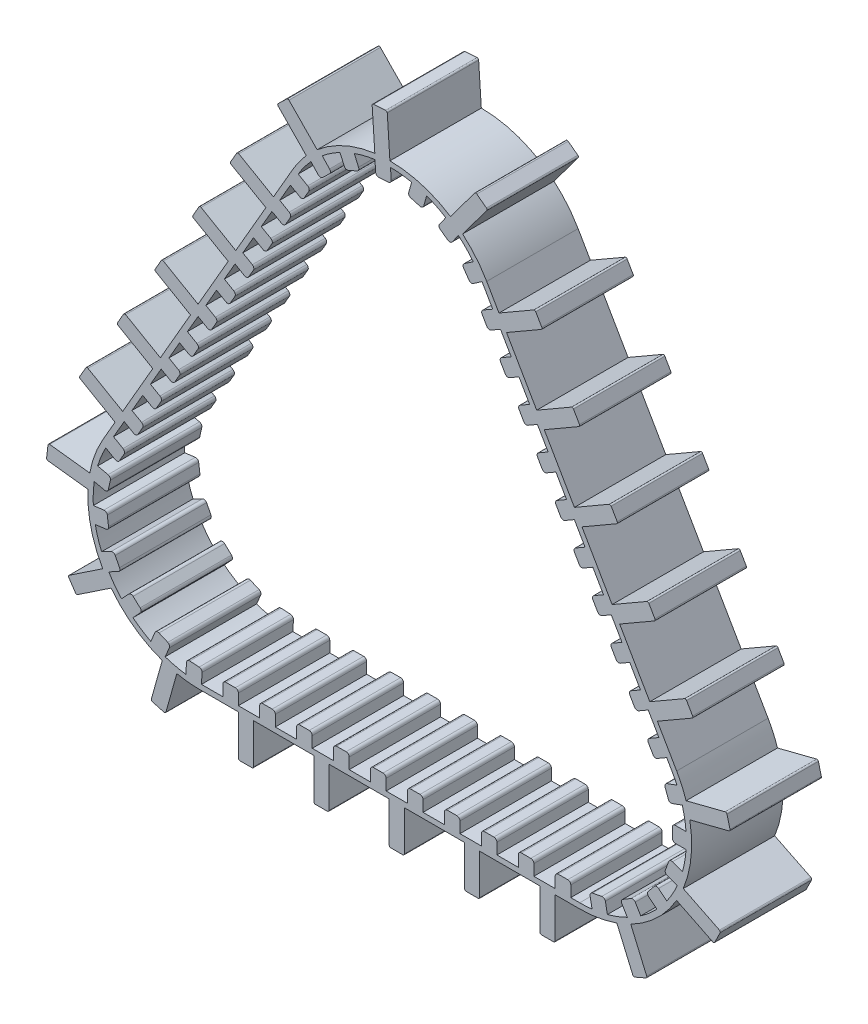
from build123d import *

# Parameters (mm, degrees)
EXTRUDE_THIN1_DEPTH = 60
BOSS_EXTRUDE4_DEPTH = 60
FILLET3_R           = 2
CRVPATTERN6_DEPTH   = 60
BOSS_EXTRUDE5_DEPTH = 60
FILLET4_R           = 1
CRVPATTERN8_DEPTH   = 60
SCALE1_SCALE        = 0.2


# Read off the part's stored shape, not the designer's step: CrvPattern6, CrvPattern8
with BuildPart() as part:
    # Sketch2 → Extrude-Thin1 (new body)
    with BuildSketch(Plane.XY):
        with BuildLine():
            Line((-249.41531629, -73.5), (0, -73.5))
            ThreePointArc((0, -73.5), (63.652867178, -36.75), (63.652867178, 36.75))
            Line((63.652867178, 36.75), (-61.054790967, 252.75))
            ThreePointArc((-61.054790967, 252.75), (-124.707658145, 289.5), (-188.360525323, 252.75))
            Line((-188.360525323, 252.75), (-313.068183468, 36.75))
            ThreePointArc((-313.068183468, 36.75), (-313.068183468, -36.75), (-249.41531629, -73.5))
        make_face()
        with BuildLine():
            Line((-249.41531629, -70), (0, -70))
            ThreePointArc((0, -70), (60.621778265, -35), (60.621778265, 35))
            Line((60.621778265, 35), (-64.08587988, 251))
            ThreePointArc((-64.08587988, 251), (-124.707658145, 286), (-185.32943641, 251))
            Line((-185.32943641, 251), (-310.037094555, 35))
            ThreePointArc((-310.037094555, 35), (-310.037094555, -35), (-249.41531629, -70))
        make_face(mode=Mode.SUBTRACT)
    extrude(amount=EXTRUDE_THIN1_DEPTH)

    # Sketch4 → Boss-Extrude4 (add)
    with BuildSketch(Plane.XY.offset(60)):
        Polygon((-254.685847855, 112.471171547), (-249.570790282, 121.330711146), (-257.538223997, 125.930711146), (-262.65328157, 117.071171547), align=None)
    extrude(amount=-BOSS_EXTRUDE4_DEPTH)

    # Fillet3
    fillet3_edges = [part.edges().sort_by_distance(p)[0] for p in [
        (-249.570790282, 121.330711146, 30),
        (-254.685847855, 112.471171547, 30),
    ]]
    fillet(fillet3_edges, radius=FILLET3_R)

    # CrvPattern6 outline → CrvPattern6 (add)
    with BuildSketch(Plane.XY):
        with BuildLine():
            ThreePointArc((-244.294746414, 134.46908719), (-242.777108324, 134.269286345), (-241.562695606, 135.201137997))
            Line((-241.562695606, 135.201137997), (-238.447638033, 140.596575981))
            ThreePointArc((-238.447638033, 140.596575981), (-238.247837188, 142.114214072), (-239.179688841, 143.328626789))
            Line((-239.179688841, 143.328626789), (-245.415071748, 146.928626789))
            Line((-245.415071748, 146.928626789), (-250.530129321, 138.06908719))
            Line((-250.530129321, 138.06908719), (-244.294746414, 134.46908719))
        make_face()
        with BuildLine():
            Line((-269.661376246, 104.932795503), (-274.776433819, 96.073255904))
            Line((-274.776433819, 96.073255904), (-268.541050911, 92.473255904))
            ThreePointArc((-268.541050911, 92.473255904), (-267.02341282, 92.273455059), (-265.809000103, 93.205306712))
            Line((-265.809000103, 93.205306712), (-262.693942531, 98.600744696))
            ThreePointArc((-262.693942531, 98.600744696), (-262.494141686, 100.118382786), (-263.425993338, 101.332795503))
            Line((-263.425993338, 101.332795503), (-269.661376246, 104.932795503))
        make_face()
        with BuildLine():
            Line((-281.784528495, 83.934879861), (-286.899586067, 75.075340262))
            Line((-286.899586067, 75.075340262), (-280.66420316, 71.475340262))
            ThreePointArc((-280.66420316, 71.475340262), (-279.14656507, 71.275539417), (-277.932152352, 72.207391069))
            Line((-277.932152352, 72.207391069), (-274.81709478, 77.602829053))
            ThreePointArc((-274.81709478, 77.602829053), (-274.617293935, 79.120467143), (-275.549145587, 80.334879861))
            Line((-275.549145587, 80.334879861), (-281.784528495, 83.934879861))
        make_face()
        with BuildLine():
            Line((-293.907680743, 62.936964218), (-299.022738316, 54.077424619))
            Line((-299.022738316, 54.077424619), (-292.787355408, 50.477424619))
            ThreePointArc((-292.787355408, 50.477424619), (-291.269717318, 50.277623774), (-290.055304601, 51.209475427))
            Line((-290.055304601, 51.209475427), (-286.940247028, 56.604913411))
            ThreePointArc((-286.940247028, 56.604913411), (-286.740446183, 58.122551501), (-287.672297836, 59.336964218))
            Line((-287.672297836, 59.336964218), (-293.907680743, 62.936964218))
        make_face()
        with BuildLine():
            ThreePointArc((-310.037094555, 35), (-310.583954637, 34.035241776), (-311.11546246, 33.061941302))
            Line((-311.11546246, 33.061941302), (-304.910507657, 29.479508976))
            ThreePointArc((-304.910507657, 29.479508976), (-303.392869566, 29.279708131), (-302.178456849, 30.211559784))
            Line((-302.178456849, 30.211559784), (-299.063399277, 35.606997768))
            ThreePointArc((-299.063399277, 35.606997768), (-298.863598432, 37.124635859), (-299.795450085, 38.339048576))
            Line((-299.795450085, 38.339048576), (-306.030832992, 41.939048576))
            Line((-306.030832992, 41.939048576), (-310.037094555, 35))
        make_face()
        with BuildLine():
            ThreePointArc((-316.457199384, 20.134197557), (-317.749224081, 15.181470482), (-318.675887828, 10.147572628))
            Line((-318.675887828, 10.147572628), (-311.829937788, 8.626635339))
            ThreePointArc((-311.829937788, 8.626635339), (-310.322340092, 8.891767267), (-309.443784123, 10.145276405))
            Line((-309.443784123, 10.145276405), (-308.092608277, 16.227106603))
            ThreePointArc((-308.092608277, 16.227106603), (-308.357740205, 17.734704298), (-309.611249343, 18.613260268))
            Line((-309.611249343, 18.613260268), (-316.457199384, 20.134197557))
        make_face()
        with BuildLine():
            ThreePointArc((-319.310913805, -3.821707469), (-318.844797619, -8.918919354), (-318.007462777, -13.968444447))
            Line((-318.007462777, -13.968444447), (-311.051754025, -13.074913281))
            ThreePointArc((-311.051754025, -13.074913281), (-309.723703566, -12.313711778), (-309.322880826, -10.836387547))
            Line((-309.322880826, -10.836387547), (-310.116679319, -4.657049503))
            ThreePointArc((-310.116679319, -4.657049503), (-310.877880823, -3.328999044), (-312.355205053, -2.928176303))
            Line((-312.355205053, -2.928176303), (-319.310913805, -3.821707469))
        make_face()
        with BuildLine():
            ThreePointArc((-313.862328281, -27.323664567), (-311.693437164, -31.959907078), (-309.191563575, -36.425269532))
            Line((-309.191563575, -36.425269532), (-302.952305235, -33.223404832))
            ThreePointArc((-302.952305235, -33.223404832), (-301.961549763, -32.056550366), (-302.086070555, -30.530889748))
            Line((-302.086070555, -30.530889748), (-304.930554857, -24.988034547))
            ThreePointArc((-304.930554857, -24.988034547), (-306.097409323, -23.997279075), (-307.623069941, -24.121799867))
            Line((-307.623069941, -24.121799867), (-313.862328281, -27.323664567))
        make_face()
        with BuildLine():
            ThreePointArc((-300.758633664, -47.580077354), (-297.144591633, -51.204650914), (-293.275355453, -54.555448533))
            Line((-293.275355453, -54.555448533), (-288.493655635, -49.42557241))
            ThreePointArc((-288.493655635, -49.42557241), (-287.957878514, -47.991665639), (-288.592952079, -46.598888802))
            Line((-288.592952079, -46.598888802), (-293.150250239, -42.350904786))
            ThreePointArc((-293.150250239, -42.350904786), (-294.58415701, -41.815127665), (-295.976933846, -42.450201231))
            Line((-295.976933846, -42.450201231), (-300.758633664, -47.580077354))
        make_face()
        with BuildLine():
            ThreePointArc((-281.556305711, -62.184859886), (-276.926393894, -64.367232417), (-272.14938858, -66.205452624))
            Line((-272.14938858, -66.205452624), (-269.393224489, -59.756899166))
            ThreePointArc((-269.393224489, -59.756899166), (-269.376066099, -58.226261606), (-270.446257484, -57.131804594))
            Line((-270.446257484, -57.131804594), (-276.175047049, -54.683273433))
            ThreePointArc((-276.175047049, -54.683273433), (-277.705684609, -54.666115044), (-278.800141621, -55.736306428))
            Line((-278.800141621, -55.736306428), (-281.556305711, -62.184859886))
        make_face()
        with BuildLine():
            Line((-249.41531629, -70), (-248.323526656, -70))
            Line((-248.323526656, -70), (-247.919788576, -62.990215199))
            ThreePointArc((-247.919788576, -62.990215199), (-248.423287016, -61.544658188), (-249.801477342, -60.878522184))
            Line((-249.801477342, -60.878522184), (-256.02128442, -60.520283945))
            ThreePointArc((-256.02128442, -60.520283945), (-257.466841431, -61.023782385), (-258.132977435, -62.40197271))
            Line((-258.132977435, -62.40197271), (-258.53622465, -69.403235016))
            ThreePointArc((-258.53622465, -69.403235016), (-253.985521366, -69.850649428), (-249.41531629, -70))
        make_face()
        with BuildLine():
            Line((-234.311365102, -70), (-224.081249957, -70))
            Line((-224.081249957, -70), (-224.081249957, -62.8))
            ThreePointArc((-224.081249957, -62.8), (-224.667036395, -61.385786437), (-226.081249957, -60.8))
            Line((-226.081249957, -60.8), (-232.311365102, -60.8))
            ThreePointArc((-232.311365102, -60.8), (-233.725578664, -61.385786438), (-234.311365102, -62.8))
            Line((-234.311365102, -62.8), (-234.311365102, -70))
        make_face()
        with BuildLine():
            Line((-210.065060604, -70), (-199.834945459, -70))
            Line((-199.834945459, -70), (-199.834945459, -62.8))
            ThreePointArc((-199.834945459, -62.8), (-200.420731897, -61.385786438), (-201.834945459, -60.8))
            Line((-201.834945459, -60.8), (-208.065060604, -60.8))
            ThreePointArc((-208.065060604, -60.8), (-209.479274167, -61.385786437), (-210.065060604, -62.8))
            Line((-210.065060604, -62.8), (-210.065060604, -70))
        make_face()
        with BuildLine():
            Line((-185.818756107, -70), (-175.588640962, -70))
            Line((-175.588640962, -70), (-175.588640962, -62.8))
            ThreePointArc((-175.588640962, -62.8), (-176.1744274, -61.385786438), (-177.588640962, -60.8))
            Line((-177.588640962, -60.8), (-183.818756107, -60.8))
            ThreePointArc((-183.818756107, -60.8), (-185.232969669, -61.385786438), (-185.818756107, -62.8))
            Line((-185.818756107, -62.8), (-185.818756107, -70))
        make_face()
        with BuildLine():
            Line((-161.57245161, -70), (-151.342336465, -70))
            Line((-151.342336465, -70), (-151.342336465, -62.8))
            ThreePointArc((-151.342336465, -62.8), (-151.928122903, -61.385786438), (-153.342336465, -60.8))
            Line((-153.342336465, -60.8), (-159.57245161, -60.8))
            ThreePointArc((-159.57245161, -60.8), (-160.986665172, -61.385786438), (-161.57245161, -62.8))
            Line((-161.57245161, -62.8), (-161.57245161, -70))
        make_face()
        with BuildLine():
            Line((-137.326147112, -70), (-127.096031967, -70))
            Line((-127.096031967, -70), (-127.096031967, -62.8))
            ThreePointArc((-127.096031967, -62.8), (-127.681818405, -61.385786438), (-129.096031967, -60.8))
            Line((-129.096031967, -60.8), (-135.326147112, -60.8))
            ThreePointArc((-135.326147112, -60.8), (-136.740360675, -61.385786437), (-137.326147112, -62.8))
            Line((-137.326147112, -62.8), (-137.326147112, -70))
        make_face()
        with BuildLine():
            Line((-113.079842615, -70), (-102.84972747, -70))
            Line((-102.84972747, -70), (-102.84972747, -62.8))
            ThreePointArc((-102.84972747, -62.8), (-103.435513907, -61.385786437), (-104.84972747, -60.8))
            Line((-104.84972747, -60.8), (-111.079842615, -60.8))
            ThreePointArc((-111.079842615, -60.8), (-112.494056177, -61.385786438), (-113.079842615, -62.8))
            Line((-113.079842615, -62.8), (-113.079842615, -70))
        make_face()
        with BuildLine():
            Line((-88.833538117, -70), (-78.603422972, -70))
            Line((-78.603422972, -70), (-78.603422972, -62.8))
            ThreePointArc((-78.603422972, -62.8), (-79.18920941, -61.385786438), (-80.603422972, -60.8))
            Line((-80.603422972, -60.8), (-86.833538117, -60.8))
            ThreePointArc((-86.833538117, -60.8), (-88.247751679, -61.385786438), (-88.833538117, -62.8))
            Line((-88.833538117, -62.8), (-88.833538117, -70))
        make_face()
        with BuildLine():
            Line((-64.58723362, -70), (-54.357118475, -70))
            Line((-54.357118475, -70), (-54.357118475, -62.8))
            ThreePointArc((-54.357118475, -62.8), (-54.942904913, -61.385786438), (-56.357118475, -60.8))
            Line((-56.357118475, -60.8), (-62.58723362, -60.8))
            ThreePointArc((-62.58723362, -60.8), (-64.001447182, -61.385786438), (-64.58723362, -62.8))
            Line((-64.58723362, -62.8), (-64.58723362, -70))
        make_face()
        with BuildLine():
            Line((-40.340929123, -70), (-30.110813978, -70))
            Line((-30.110813978, -70), (-30.110813978, -62.8))
            ThreePointArc((-30.110813978, -62.8), (-30.696600416, -61.385786437), (-32.110813978, -60.8))
            Line((-32.110813978, -60.8), (-38.340929123, -60.8))
            ThreePointArc((-38.340929123, -60.8), (-39.755142685, -61.385786438), (-40.340929123, -62.8))
            Line((-40.340929123, -62.8), (-40.340929123, -70))
        make_face()
        with BuildLine():
            Line((-16.094624625, -70), (-5.86450948, -70))
            Line((-5.86450948, -70), (-5.86450948, -62.8))
            ThreePointArc((-5.86450948, -62.8), (-6.450295918, -61.385786438), (-7.86450948, -60.8))
            Line((-7.86450948, -60.8), (-14.094624625, -60.8))
            ThreePointArc((-14.094624625, -60.8), (-15.508838188, -61.385786437), (-16.094624625, -62.8))
            Line((-16.094624625, -62.8), (-16.094624625, -70))
        make_face()
        with BuildLine():
            ThreePointArc((8.128735827, -69.526424141), (13.187457187, -68.746570627), (18.175669161, -67.599149777))
            Line((18.175669161, -67.599149777), (16.854499686, -60.711857609))
            ThreePointArc((16.854499686, -60.711857609), (16.01277555, -59.433324766), (14.513527463, -59.124454368))
            Line((14.513527463, -59.124454368), (8.394969594, -60.29815975))
            ThreePointArc((8.394969594, -60.29815975), (7.116436751, -61.139883886), (6.807566352, -62.639131973))
            Line((6.807566352, -62.639131973), (8.128735827, -69.526424141))
        make_face()
        with BuildLine():
            ThreePointArc((31.249564339, -62.637566433), (35.743091285, -60.186638263), (40.04551062, -57.413910154))
            Line((40.04551062, -57.413910154), (36.464632178, -51.384184474))
            ThreePointArc((36.464632178, -51.384184474), (35.238848166, -50.467342446), (33.723782763, -50.685797418))
            Line((33.723782763, -50.685797418), (28.367072955, -53.866991337))
            ThreePointArc((28.367072955, -53.866991337), (27.450230926, -55.092775349), (27.668685898, -56.607840752))
            Line((27.668685898, -56.607840752), (31.249564339, -62.637566433))
        make_face()
        with BuildLine():
            ThreePointArc((50.6585245, -48.308528186), (54.053109415, -44.477650146), (57.158688534, -40.408963425))
            Line((57.158688534, -40.408963425), (51.743443035, -35.953023751))
            ThreePointArc((51.743443035, -35.953023751), (50.27919954, -35.506776356), (48.928278477, -36.226608301))
            Line((48.928278477, -36.226608301), (44.969694451, -41.037423953))
            ThreePointArc((44.969694451, -41.037423953), (44.523447056, -42.501667448), (45.243279001, -43.852588512))
            Line((45.243279001, -43.852588512), (50.6585245, -48.308528186))
        make_face()
        with BuildLine():
            ThreePointArc((64.050192012, -28.241333242), (65.942621201, -23.485542555), (67.482474934, -18.604181702))
            Line((67.482474934, -18.604181702), (60.876093053, -16.251310979))
            ThreePointArc((60.876093053, -16.251310979), (59.347315031, -16.328664127), (58.32100266, -17.464370369))
            Line((58.32100266, -17.464370369), (56.230750741, -23.333372127))
            ThreePointArc((56.230750741, -23.333372127), (56.308103889, -24.862150149), (57.443810131, -25.88846252))
            Line((57.443810131, -25.88846252), (64.050192012, -28.241333242))
        make_face()
        with BuildLine():
            ThreePointArc((69.833885279, -4.819591979), (69.999373273, 0.296211675), (69.790595571, 5.410431573))
            Line((69.790595571, 5.410431573), (62.777792883, 5.380755964))
            ThreePointArc((62.777792883, 5.380755964), (61.366070793, 4.788990392), (60.78627398, 3.37231068))
            Line((60.78627398, 3.37231068), (60.812637306, -2.857748685))
            ThreePointArc((60.812637306, -2.857748685), (61.404402878, -4.269470774), (62.82108259, -4.849267588))
            Line((62.82108259, -4.849267588), (69.833885279, -4.819591979))
        make_face()
        with BuildLine():
            ThreePointArc((67.32260887, 19.174627375), (65.741498766, 24.042781454), (63.808888546, 28.782385978))
            Line((63.808888546, 28.782385978), (57.222655873, 26.373688949))
            ThreePointArc((57.222655873, 26.373688949), (56.095676104, 25.337801721), (56.03126395, 23.8084238))
            Line((56.03126395, 23.8084238), (58.171111048, 17.957322269))
            ThreePointArc((58.171111048, 17.957322269), (59.206998276, 16.8303425), (60.736376197, 16.765930346))
            Line((60.736376197, 16.765930346), (67.32260887, 19.174627375))
        make_face()
        with BuildLine():
            Line((57.11085342, 41.081100212), (51.995795848, 49.940639812))
            Line((51.995795848, 49.940639812), (45.760412941, 46.340639812))
            ThreePointArc((45.760412941, 46.340639812), (44.828561288, 45.126227095), (45.028362133, 43.608589004))
            Line((45.028362133, 43.608589004), (48.143419706, 38.21315102))
            ThreePointArc((48.143419706, 38.21315102), (49.357832423, 37.281299367), (50.875470513, 37.481100212))
            Line((50.875470513, 37.481100212), (57.11085342, 41.081100212))
        make_face()
        with BuildLine():
            Line((44.987701172, 62.079015855), (39.872643599, 70.938555454))
            Line((39.872643599, 70.938555454), (33.637260692, 67.338555454))
            ThreePointArc((33.637260692, 67.338555454), (32.705409039, 66.124142737), (32.905209884, 64.606504647))
            Line((32.905209884, 64.606504647), (36.020267457, 59.211066662))
            ThreePointArc((36.020267457, 59.211066662), (37.234680174, 58.27921501), (38.752318264, 58.479015855))
            Line((38.752318264, 58.479015855), (44.987701172, 62.079015855))
        make_face()
        with BuildLine():
            Line((32.864548923, 83.076931498), (27.74949135, 91.936471097))
            Line((27.74949135, 91.936471097), (21.514108443, 88.336471097))
            ThreePointArc((21.514108443, 88.336471097), (20.582256791, 87.122058379), (20.782057636, 85.604420289))
            Line((20.782057636, 85.604420289), (23.897115208, 80.208982305))
            ThreePointArc((23.897115208, 80.208982305), (25.111527926, 79.277130653), (26.629166016, 79.476931498))
            Line((26.629166016, 79.476931498), (32.864548923, 83.076931498))
        make_face()
        with BuildLine():
            Line((20.741396674, 104.07484714), (15.626339102, 112.934386739))
            Line((15.626339102, 112.934386739), (9.390956195, 109.334386739))
            ThreePointArc((9.390956195, 109.334386739), (8.459104542, 108.119974022), (8.658905387, 106.602335932))
            Line((8.658905387, 106.602335932), (11.773962959, 101.206897948))
            ThreePointArc((11.773962959, 101.206897948), (12.988375676, 100.275046295), (14.506013767, 100.47484714))
            Line((14.506013767, 100.47484714), (20.741396674, 104.07484714))
        make_face()
        with BuildLine():
            Line((8.618244426, 125.072762783), (3.503186853, 133.932302382))
            Line((3.503186853, 133.932302382), (-2.732196054, 130.332302382))
            ThreePointArc((-2.732196054, 130.332302382), (-3.664047707, 129.117889665), (-3.464246862, 127.600251574))
            Line((-3.464246862, 127.600251574), (-0.349189289, 122.20481359))
            ThreePointArc((-0.349189289, 122.20481359), (0.865223428, 121.272961938), (2.382861518, 121.472762783))
            Line((2.382861518, 121.472762783), (8.618244426, 125.072762783))
        make_face()
        with BuildLine():
            Line((-3.504907823, 146.070678425), (-8.619965396, 154.930218025))
            Line((-8.619965396, 154.930218025), (-14.855348303, 151.330218025))
            ThreePointArc((-14.855348303, 151.330218025), (-15.787199955, 150.115805307), (-15.58739911, 148.598167217))
            Line((-15.58739911, 148.598167217), (-12.472341538, 143.202729233))
            ThreePointArc((-12.472341538, 143.202729233), (-11.257928821, 142.27087758), (-9.74029073, 142.470678425))
            Line((-9.74029073, 142.470678425), (-3.504907823, 146.070678425))
        make_face()
        with BuildLine():
            Line((-15.628060072, 167.068594068), (-20.743117644, 175.928133667))
            Line((-20.743117644, 175.928133667), (-26.978500552, 172.328133667))
            ThreePointArc((-26.978500552, 172.328133667), (-27.910352204, 171.11372095), (-27.710551359, 169.59608286))
            Line((-27.710551359, 169.59608286), (-24.595493787, 164.200644876))
            ThreePointArc((-24.595493787, 164.200644876), (-23.38108107, 163.268793223), (-21.863442979, 163.468594068))
            Line((-21.863442979, 163.468594068), (-15.628060072, 167.068594068))
        make_face()
        with BuildLine():
            Line((-27.75121232, 188.066509711), (-32.866269893, 196.92604931))
            Line((-32.866269893, 196.92604931), (-39.1016528, 193.32604931))
            ThreePointArc((-39.1016528, 193.32604931), (-40.033504453, 192.111636593), (-39.833703608, 190.593998502))
            Line((-39.833703608, 190.593998502), (-36.718646035, 185.198560518))
            ThreePointArc((-36.718646035, 185.198560518), (-35.504233318, 184.266708866), (-33.986595228, 184.466509711))
            Line((-33.986595228, 184.466509711), (-27.75121232, 188.066509711))
        make_face()
        with BuildLine():
            Line((-39.874364569, 209.064425353), (-44.989422142, 217.923964953))
            Line((-44.989422142, 217.923964953), (-51.224805049, 214.323964953))
            ThreePointArc((-51.224805049, 214.323964953), (-52.156656702, 213.109552236), (-51.956855857, 211.591914145))
            Line((-51.956855857, 211.591914145), (-48.841798284, 206.196476161))
            ThreePointArc((-48.841798284, 206.196476161), (-47.627385567, 205.264624508), (-46.109747476, 205.464425353))
            Line((-46.109747476, 205.464425353), (-39.874364569, 209.064425353))
        make_face()
        with BuildLine():
            Line((-51.997516818, 230.062340996), (-57.11257439, 238.921880595))
            Line((-57.11257439, 238.921880595), (-63.347957298, 235.321880595))
            ThreePointArc((-63.347957298, 235.321880595), (-64.27980895, 234.107467878), (-64.080008105, 232.589829788))
            Line((-64.080008105, 232.589829788), (-60.964950533, 227.194391804))
            ThreePointArc((-60.964950533, 227.194391804), (-59.750537816, 226.262540151), (-58.232899725, 226.462340996))
            Line((-58.232899725, 226.462340996), (-51.997516818, 230.062340996))
        make_face()
        with BuildLine():
            ThreePointArc((-64.118413713, 251.056289866), (-66.842032003, 255.389964601), (-69.875040476, 259.513032985))
            Line((-69.875040476, 259.513032985), (-75.67223836, 255.566796944))
            ThreePointArc((-75.67223836, 255.566796944), (-76.511670449, 254.28675807), (-76.200114404, 252.78806578))
            Line((-76.200114404, 252.78806578), (-72.69434276, 247.637929869))
            ThreePointArc((-72.69434276, 247.637929869), (-71.414303886, 246.79849778), (-69.915611596, 247.110053825))
            Line((-69.915611596, 247.110053825), (-64.118413713, 251.056289866))
        make_face()
        with BuildLine():
            ThreePointArc((-79.618149954, 269.543778827), (-83.651254454, 272.69542941), (-87.903875255, 275.543946501))
            Line((-87.903875255, 275.543946501), (-92.017061484, 269.863983365))
            ThreePointArc((-92.017061484, 269.863983365), (-92.372077331, 268.374987226), (-91.570232177, 267.071073847))
            Line((-91.570232177, 267.071073847), (-86.5242457, 263.416986384))
            ThreePointArc((-86.5242457, 263.416986384), (-85.035249562, 263.061970537), (-83.731336183, 263.86381569))
            Line((-83.731336183, 263.86381569), (-79.618149954, 269.543778827))
        make_face()
        with BuildLine():
            ThreePointArc((-100.47368305, 281.671260465), (-105.337215786, 283.266529291), (-110.304316479, 284.502144119))
            Line((-110.304316479, 284.502144119), (-112.244920858, 277.763128105))
            ThreePointArc((-112.244920858, 277.763128105), (-112.073351168, 276.242039813), (-110.876461231, 275.287786058))
            Line((-110.876461231, 275.287786058), (-104.889629475, 273.563784825))
            ThreePointArc((-104.889629475, 273.563784825), (-103.368541183, 273.735354514), (-102.414287428, 274.932244451))
            Line((-102.414287428, 274.932244451), (-100.47368305, 281.671260465))
        make_face()
        with BuildLine():
            ThreePointArc((-124.207762682, 285.99821501), (-129.324026217, 285.847613745), (-134.415607414, 285.323558196))
            Line((-134.415607414, 285.323558196), (-133.953122153, 278.325959353))
            ThreePointArc((-133.953122153, 278.325959353), (-133.275346222, 276.953455969), (-131.825579815, 276.462209476))
            Line((-131.825579815, 276.462209476), (-125.609027297, 276.873073829))
            ThreePointArc((-125.609027297, 276.873073829), (-124.236523914, 277.55084976), (-123.745277421, 279.000616166))
            Line((-123.745277421, 279.000616166), (-124.207762682, 285.99821501))
        make_face()
        with BuildLine():
            ThreePointArc((-148.001220619, 282.010680555), (-152.762497787, 280.132097835), (-157.373774124, 277.910619984))
            Line((-157.373774124, 277.910619984), (-154.56313389, 271.485623201))
            ThreePointArc((-154.56313389, 271.485623201), (-153.459658921, 270.424732659), (-151.929221391, 270.454844396))
            Line((-151.929221391, 270.454844396), (-146.221359191, 272.951771272))
            ThreePointArc((-146.221359191, 272.951771272), (-145.160468648, 274.055246241), (-145.190580385, 275.585683771))
            Line((-145.190580385, 275.585683771), (-148.001220619, 282.010680555))
        make_face()
        with BuildLine():
            ThreePointArc((-169.027835588, 270.182302197), (-172.868575015, 266.798878789), (-176.451812435, 263.143848982))
            Line((-176.451812435, 263.143848982), (-171.626869131, 258.054624649))
            ThreePointArc((-171.626869131, 258.054624649), (-170.228767473, 257.431361058), (-168.799446398, 257.979254309))
            Line((-168.799446398, 257.979254309), (-164.278262625, 262.265655131))
            ThreePointArc((-164.278262625, 262.265655131), (-163.654999034, 263.663756789), (-164.202892285, 265.093077865))
            Line((-164.202892285, 265.093077865), (-169.027835588, 270.182302197))
        make_face()
        with BuildLine():
            Line((-185.32943641, 251), (-189.914368077, 243.058665403))
            Line((-189.914368077, 243.058665403), (-183.67898517, 239.458665403))
            ThreePointArc((-183.67898517, 239.458665403), (-182.16134708, 239.258864558), (-180.946934363, 240.19071621))
            Line((-180.946934363, 240.19071621), (-177.83187679, 245.586154194))
            ThreePointArc((-177.83187679, 245.586154194), (-177.632075945, 247.103792285), (-178.563927598, 248.318205002))
            Line((-178.563927598, 248.318205002), (-184.792356331, 251.914190008))
            ThreePointArc((-184.792356331, 251.914190008), (-185.062627287, 251.458111905), (-185.32943641, 251))
        make_face()
        with BuildLine():
            Line((-196.922462754, 230.920289359), (-202.037520326, 222.06074976))
            Line((-202.037520326, 222.06074976), (-195.802137419, 218.46074976))
            ThreePointArc((-195.802137419, 218.46074976), (-194.284499328, 218.260948915), (-193.070086611, 219.192800568))
            Line((-193.070086611, 219.192800568), (-189.955029039, 224.588238552))
            ThreePointArc((-189.955029039, 224.588238552), (-189.755228194, 226.105876642), (-190.687079846, 227.320289359))
            Line((-190.687079846, 227.320289359), (-196.922462754, 230.920289359))
        make_face()
        with BuildLine():
            Line((-209.045615002, 209.922373717), (-214.160672575, 201.062834117))
            Line((-214.160672575, 201.062834117), (-207.925289667, 197.462834117))
            ThreePointArc((-207.925289667, 197.462834117), (-206.407651577, 197.263033272), (-205.19323886, 198.194884925))
            Line((-205.19323886, 198.194884925), (-202.078181287, 203.590322909))
            ThreePointArc((-202.078181287, 203.590322909), (-201.878380442, 205.107961), (-202.810232095, 206.322373717))
            Line((-202.810232095, 206.322373717), (-209.045615002, 209.922373717))
        make_face()
        with BuildLine():
            Line((-221.168767251, 188.924458074), (-226.283824823, 180.064918475))
            Line((-226.283824823, 180.064918475), (-220.048441916, 176.464918475))
            ThreePointArc((-220.048441916, 176.464918475), (-218.530803826, 176.26511763), (-217.316391109, 177.196969282))
            Line((-217.316391109, 177.196969282), (-214.201333536, 182.592407266))
            ThreePointArc((-214.201333536, 182.592407266), (-214.001532691, 184.110045357), (-214.933384344, 185.324458074))
            Line((-214.933384344, 185.324458074), (-221.168767251, 188.924458074))
        make_face()
        with BuildLine():
            Line((-233.2919195, 167.926542431), (-238.406977072, 159.067002832))
            Line((-238.406977072, 159.067002832), (-232.171594165, 155.467002832))
            ThreePointArc((-232.171594165, 155.467002832), (-230.653956074, 155.267201987), (-229.439543357, 156.19905364))
            Line((-229.439543357, 156.19905364), (-226.324485785, 161.594491624))
            ThreePointArc((-226.324485785, 161.594491624), (-226.12468494, 163.112129714), (-227.056536592, 164.326542431))
            Line((-227.056536592, 164.326542431), (-233.2919195, 167.926542431))
        make_face()
    extrude(amount=CRVPATTERN6_DEPTH)

    # Sketch6 → Boss-Extrude5 (add)
    with BuildSketch(Plane.XY.offset(60)):
        Polygon((-136.308864095, 316.253168116), (-126.401592242, 316.907959468), (-124.406757868, 286.725266347), (-134.314029721, 286.070474994), align=None)
    extrude(amount=-BOSS_EXTRUDE5_DEPTH)

    # Fillet4
    fillet4_edges = [part.edges().sort_by_distance(p)[0] for p in [
        (-126.401592242, 316.907959468, 30),
        (-136.308864095, 316.253168116, 30),
    ]]
    fillet(fillet4_edges, radius=FILLET4_R)

    # CrvPattern8 outline → CrvPattern8 (add)
    with BuildSketch(Plane.XY):
        with BuildLine():
            ThreePointArc((-67.591407991, 299.151011892), (-68.333266762, 299.339245794), (-68.990941598, 298.947773895))
            Line((-68.990941598, 298.947773895), (-84.82262764, 277.736815123))
            ThreePointArc((-84.82262764, 277.736815123), (-80.743794517, 274.901856463), (-76.865758962, 271.797873458))
            Line((-76.865758962, 271.797873458), (-61.034072919, 293.008832229))
            ThreePointArc((-61.034072919, 293.008832229), (-60.845839018, 293.750691), (-61.237310917, 294.408365836))
            Line((-61.237310917, 294.408365836), (-67.591407991, 299.151011892))
        make_face()
        with BuildLine():
            Line((-197.962453997, 283.958962481), (-179.476921648, 265.016097105))
            ThreePointArc((-179.476921648, 265.016097105), (-176.041130848, 268.603465478), (-172.370883027, 271.95057635))
            Line((-172.370883027, 271.95057635), (-190.856415376, 290.893441726))
            ThreePointArc((-190.856415376, 290.893441726), (-191.559890817, 291.19495249), (-192.270523378, 290.91072054))
            Line((-192.270523378, 290.91072054), (-197.945175183, 285.373070484))
            ThreePointArc((-197.945175183, 285.373070484), (-198.246685947, 284.669595042), (-197.962453997, 283.958962481))
        make_face()
        with BuildLine():
            Line((-228.780032887, 235.341359283), (-206.003564767, 222.191359283))
            Line((-206.003564767, 222.191359283), (-201.039121513, 230.79002723))
            Line((-201.039121513, 230.79002723), (-223.815589633, 243.94002723))
            ThreePointArc((-223.815589633, 243.94002723), (-224.574408678, 244.039927652), (-225.181615037, 243.574001826))
            Line((-225.181615037, 243.574001826), (-229.146058291, 236.707384686))
            ThreePointArc((-229.146058291, 236.707384686), (-229.245958713, 235.948565641), (-228.780032887, 235.341359283))
        make_face()
        with BuildLine():
            Line((-253.531468728, 192.470614846), (-230.755000608, 179.320614846))
            Line((-230.755000608, 179.320614846), (-225.790557354, 187.919282793))
            Line((-225.790557354, 187.919282793), (-248.567025474, 201.069282793))
            ThreePointArc((-248.567025474, 201.069282793), (-249.325844519, 201.169183215), (-249.933050878, 200.703257389))
            Line((-249.933050878, 200.703257389), (-253.897494132, 193.836640249))
            ThreePointArc((-253.897494132, 193.836640249), (-253.997394554, 193.077821204), (-253.531468728, 192.470614846))
        make_face()
        with BuildLine():
            Line((-278.282904569, 149.599870409), (-255.506436449, 136.449870409))
            Line((-255.506436449, 136.449870409), (-250.541993196, 145.048538355))
            Line((-250.541993196, 145.048538355), (-273.318461315, 158.198538355))
            ThreePointArc((-273.318461315, 158.198538355), (-274.07728036, 158.298438778), (-274.684486719, 157.832512952))
            Line((-274.684486719, 157.832512952), (-278.648929973, 150.965895812))
            ThreePointArc((-278.648929973, 150.965895812), (-278.748830395, 150.207076767), (-278.282904569, 149.599870409))
        make_face()
        with BuildLine():
            Line((-303.03434041, 106.729125972), (-280.257872291, 93.579125972))
            Line((-280.257872291, 93.579125972), (-275.293429037, 102.177793918))
            Line((-275.293429037, 102.177793918), (-298.069897156, 115.327793918))
            ThreePointArc((-298.069897156, 115.327793918), (-298.828716201, 115.427694341), (-299.43592256, 114.961768515))
            Line((-299.43592256, 114.961768515), (-303.400365814, 108.095151375))
            ThreePointArc((-303.400365814, 108.095151375), (-303.500266236, 107.33633233), (-303.03434041, 106.729125972))
        make_face()
        with BuildLine():
            Line((-327.785776251, 63.858381534), (-305.009308132, 50.708381534))
            Line((-305.009308132, 50.708381534), (-300.044864878, 59.307049481))
            Line((-300.044864878, 59.307049481), (-322.821332997, 72.457049481))
            ThreePointArc((-322.821332997, 72.457049481), (-323.580152042, 72.556949904), (-324.187358401, 72.091024078))
            Line((-324.187358401, 72.091024078), (-328.151801655, 65.224406938))
            ThreePointArc((-328.151801655, 65.224406938), (-328.251702078, 64.465587893), (-327.785776251, 63.858381534))
        make_face()
        with BuildLine():
            Line((-349.108553943, 6.778204998), (-322.823481788, 3.673042086))
            ThreePointArc((-322.823481788, 3.673042086), (-322.407752132, 8.622894519), (-321.658641774, 13.533363329))
            Line((-321.658641774, 13.533363329), (-347.943713929, 16.638526241))
            ThreePointArc((-347.943713929, 16.638526241), (-348.680299421, 16.430612196), (-349.054126587, 15.762750169))
            Line((-349.054126587, 15.762750169), (-349.984330016, 7.888617656))
            ThreePointArc((-349.984330016, 7.888617656), (-349.776415971, 7.152032163), (-349.108553943, 6.778204998))
        make_face()
        with BuildLine():
            Line((-329.605337658, -59.617498856), (-307.606159636, -44.900732184))
            ThreePointArc((-307.606159636, -44.900732184), (-310.506021344, -40.867783841), (-313.126861508, -36.648178753))
            Line((-313.126861508, -36.648178753), (-335.12603953, -51.364945425))
            ThreePointArc((-335.12603953, -51.364945425), (-335.550906945, -52.001556858), (-335.401181315, -52.75213575))
            Line((-335.401181315, -52.75213575), (-330.992527983, -59.34235707))
            ThreePointArc((-330.992527983, -59.34235707), (-330.35591655, -59.767224486), (-329.605337658, -59.617498856))
        make_face()
        with BuildLine():
            Line((-271.642106288, -97.419995397), (-264.479869825, -71.939622092))
            ThreePointArc((-264.479869825, -71.939622092), (-269.304517369, -70.757824164), (-274.038324324, -69.252851749))
            Line((-274.038324324, -69.252851749), (-281.200560786, -94.733225054))
            ThreePointArc((-281.200560786, -94.733225054), (-281.109939046, -95.493208039), (-280.508470676, -95.966517914))
            Line((-280.508470676, -95.966517914), (-272.875399148, -98.112085507))
            ThreePointArc((-272.875399148, -98.112085507), (-272.115416163, -98.021463767), (-271.642106288, -97.419995397))
        make_face()
        with BuildLine():
            Line((-214.129237401, -99.8), (-214.129237401, -73.5))
            Line((-214.129237401, -73.5), (-224.058123909, -73.5))
            Line((-224.058123909, -73.5), (-224.058123909, -99.8))
            ThreePointArc((-224.058123909, -99.8), (-223.76523069, -100.507106781), (-223.058123909, -100.8))
            Line((-223.058123909, -100.8), (-215.129237401, -100.8))
            ThreePointArc((-215.129237401, -100.8), (-214.42213062, -100.507106781), (-214.129237401, -99.8))
        make_face()
        with BuildLine():
            Line((-164.626365719, -99.8), (-164.626365719, -73.5))
            Line((-164.626365719, -73.5), (-174.555252227, -73.5))
            Line((-174.555252227, -73.5), (-174.555252227, -99.8))
            ThreePointArc((-174.555252227, -99.8), (-174.262359008, -100.507106781), (-173.555252227, -100.8))
            Line((-173.555252227, -100.8), (-165.626365719, -100.8))
            ThreePointArc((-165.626365719, -100.8), (-164.919258938, -100.507106781), (-164.626365719, -99.8))
        make_face()
        with BuildLine():
            Line((-115.123494037, -99.8), (-115.123494037, -73.5))
            Line((-115.123494037, -73.5), (-125.052380545, -73.5))
            Line((-125.052380545, -73.5), (-125.052380545, -99.8))
            ThreePointArc((-125.052380545, -99.8), (-124.759487326, -100.507106781), (-124.052380545, -100.8))
            Line((-124.052380545, -100.8), (-116.123494037, -100.8))
            ThreePointArc((-116.123494037, -100.8), (-115.416387256, -100.507106781), (-115.123494037, -99.8))
        make_face()
        with BuildLine():
            Line((-65.620622355, -99.8), (-65.620622355, -73.5))
            Line((-65.620622355, -73.5), (-75.549508863, -73.5))
            Line((-75.549508863, -73.5), (-75.549508863, -99.8))
            ThreePointArc((-75.549508863, -99.8), (-75.256615644, -100.507106781), (-74.549508863, -100.8))
            Line((-74.549508863, -100.8), (-66.620622355, -100.8))
            ThreePointArc((-66.620622355, -100.8), (-65.913515574, -100.507106781), (-65.620622355, -99.8))
        make_face()
        with BuildLine():
            Line((-16.117750673, -99.8), (-16.117750673, -73.5))
            Line((-16.117750673, -73.5), (-26.04663718, -73.5))
            Line((-26.04663718, -73.5), (-26.04663718, -99.8))
            ThreePointArc((-26.04663718, -99.8), (-25.753743962, -100.507106781), (-25.04663718, -100.8))
            Line((-25.04663718, -100.8), (-17.117750673, -100.8))
            ThreePointArc((-17.117750673, -100.8), (-16.410643892, -100.507106781), (-16.117750673, -99.8))
        make_face()
        with BuildLine():
            Line((43.976521107, -89.725978892), (33.523134994, -65.40985721))
            ThreePointArc((33.523134994, -65.40985721), (29.028572213, -67.524750983), (24.4014263, -69.331236788))
            Line((24.4014263, -69.331236788), (34.854812413, -93.64735847))
            ThreePointArc((34.854812413, -93.64735847), (35.403164004, -94.181303196), (36.168463069, -94.171116005))
            Line((36.168463069, -94.171116005), (43.452763572, -91.039629548))
            ThreePointArc((43.452763572, -91.039629548), (43.986708298, -90.491277957), (43.976521107, -89.725978892))
        make_face()
        with BuildLine():
            Line((91.725279203, -39.637846207), (67.980596393, -27.944382513))
            ThreePointArc((67.980596393, -27.944382513), (65.937891529, -32.472210591), (63.594026412, -36.851727296))
            Line((63.594026412, -36.851727296), (87.338709222, -48.54519099))
            ThreePointArc((87.338709222, -48.54519099), (88.102464603, -48.594831249), (88.677622176, -48.089875603))
            Line((88.677622176, -48.089875603), (92.18059459, -40.976759161))
            ThreePointArc((92.18059459, -40.976759161), (92.230234849, -40.21300378), (91.725279203, -39.637846207))
        make_face()
        with BuildLine():
            Line((95.48158585, 29.461032916), (69.833817038, 22.923524988))
            ThreePointArc((69.833817038, 22.923524988), (71.222673782, 18.154358687), (72.286232916, 13.302275399))
            Line((72.286232916, 13.302275399), (97.934001727, 19.839783327))
            ThreePointArc((97.934001727, 19.839783327), (98.546855429, 20.298255549), (98.65601962, 21.055797375))
            Line((98.65601962, 21.055797375), (96.697599897, 28.739015023))
            ThreePointArc((96.697599897, 28.739015023), (96.239127675, 29.351868725), (95.48158585, 29.461032916))
        make_face()
        with BuildLine():
            Line((68.786295853, 80.458640717), (46.009827734, 67.308640717))
            Line((46.009827734, 67.308640717), (50.974270988, 58.70997277))
            Line((50.974270988, 58.70997277), (73.750739107, 71.85997277))
            ThreePointArc((73.750739107, 71.85997277), (74.216664934, 72.467179129), (74.116764511, 73.225998174))
            Line((74.116764511, 73.225998174), (70.152321257, 80.092615314))
            ThreePointArc((70.152321257, 80.092615314), (69.545114898, 80.55854114), (68.786295853, 80.458640717))
        make_face()
        with BuildLine():
            Line((44.034860012, 123.329385154), (21.258391893, 110.179385154))
            Line((21.258391893, 110.179385154), (26.222835147, 101.580717207))
            Line((26.222835147, 101.580717207), (48.999303266, 114.730717207))
            ThreePointArc((48.999303266, 114.730717207), (49.465229092, 115.337923566), (49.36532867, 116.096742611))
            Line((49.36532867, 116.096742611), (45.400885416, 122.963359751))
            ThreePointArc((45.400885416, 122.963359751), (44.793679057, 123.429285577), (44.034860012, 123.329385154))
        make_face()
        with BuildLine():
            Line((19.283424171, 166.200129591), (-3.493043948, 153.050129591))
            Line((-3.493043948, 153.050129591), (1.471399305, 144.451461645))
            Line((1.471399305, 144.451461645), (24.247867425, 157.601461645))
            ThreePointArc((24.247867425, 157.601461645), (24.713793251, 158.208668003), (24.613892829, 158.967487048))
            Line((24.613892829, 158.967487048), (20.649449575, 165.834104188))
            ThreePointArc((20.649449575, 165.834104188), (20.042243216, 166.300030014), (19.283424171, 166.200129591))
        make_face()
        with BuildLine():
            Line((-5.46801167, 209.070874028), (-28.244479789, 195.920874028))
            Line((-28.244479789, 195.920874028), (-23.280036536, 187.322206082))
            Line((-23.280036536, 187.322206082), (-0.503568416, 200.472206082))
            ThreePointArc((-0.503568416, 200.472206082), (-0.03764259, 201.07941244), (-0.137543012, 201.838231485))
            Line((-0.137543012, 201.838231485), (-4.101986266, 208.704848625))
            ThreePointArc((-4.101986266, 208.704848625), (-4.709192625, 209.170774451), (-5.46801167, 209.070874028))
        make_face()
        with BuildLine():
            Line((-30.219447511, 251.941618466), (-52.99591563, 238.791618466))
            Line((-52.99591563, 238.791618466), (-48.031472377, 230.192950519))
            Line((-48.031472377, 230.192950519), (-25.255004257, 243.342950519))
            ThreePointArc((-25.255004257, 243.342950519), (-24.789078431, 243.950156877), (-24.888978853, 244.708975922))
            Line((-24.888978853, 244.708975922), (-28.853422107, 251.575593062))
            ThreePointArc((-28.853422107, 251.575593062), (-29.460628466, 252.041518888), (-30.219447511, 251.941618466))
        make_face()
    extrude(amount=CRVPATTERN8_DEPTH)


with BuildPart() as part_1:
    # Scale1: scaled about (-124.70980796, 72.001247735, 30)
    add(part.part.scale(SCALE1_SCALE).moved(Location((-99.767846368, 57.600998188, 24))))


solid = part_1.part
